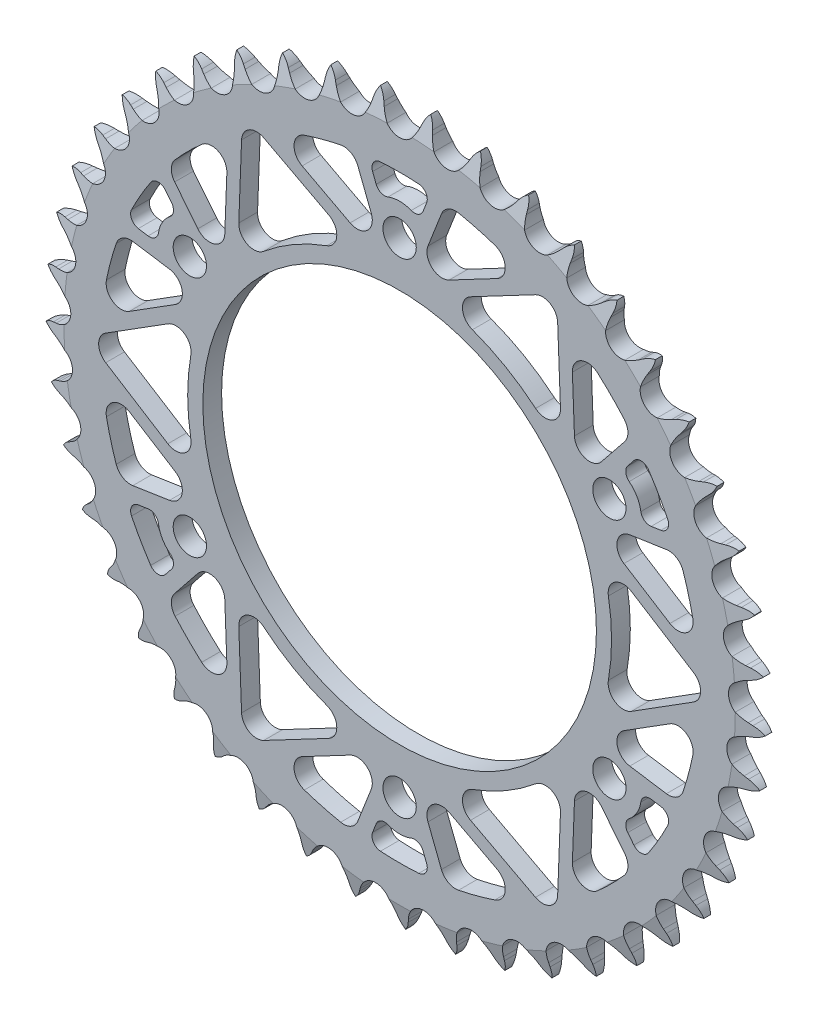
from build123d import *

# Parameters (mm, degrees)
BOSS_EXTRUDE2_DEPTH      = 6.1976
M10_CLEARANCE_HOLE1_D    = 11
SKETCH5_R                = 65
CUT_EXTRUDE1_DEPTH       = 169.066931826
CUT_EXTRUDE5_DEPTH       = 169.066931826
FILLET5_R                = 5
FILLET6_R                = 5
FILLET7_R                = 3
CIRPATTERN1_COUNT        = 6
FILLET5_OF_CIRPATTERN1_R = 5
FILLET6_OF_CIRPATTERN1_R = 5
FILLET7_OF_CIRPATTERN1_R = 3


with BuildPart() as part:
    # Sketch2 → Boss-Extrude2 (new body)
    with BuildSketch(Plane.XY):
        with BuildLine():
            Line((5.956451436, 114.157319132), (6.387056113, 115.368083346))
            ThreePointArc((6.387056113, 115.368083346), (7.1593932, 117.045110566), (8.28683305, 118.507233768))
            ThreePointArc((8.28683305, 118.507233768), (9.199812512, 116.902430548), (9.731236189, 115.134235494))
            Line((9.731236189, 115.134235494), (9.989144441, 113.875325767))
            ThreePointArc((9.989144441, 113.875325767), (10.526532851, 112.014172711), (11.32913636, 110.251077533))
            ThreePointArc((11.32913636, 110.251077533), (15.123673948, 107.610531699), (19.499050656, 109.102870958))
            ThreePointArc((19.499050656, 109.102870958), (20.75653756, 110.57643931), (21.786111761, 112.217370132))
            Line((21.786111761, 112.217370132), (22.381031633, 113.356422684))
            ThreePointArc((22.381031633, 113.356422684), (23.379249467, 114.909640643), (24.69920537, 116.200625263))
            ThreePointArc((24.69920537, 116.200625263), (25.379954338, 114.484377695), (25.660121047, 112.659430712))
            Line((25.660121047, 112.659430712), (25.740312983, 111.376878716))
            ThreePointArc((25.740312983, 111.376878716), (26.013449124, 109.459048263), (26.562866328, 107.601410587))
            ThreePointArc((26.562866328, 107.601410587), (29.952982785, 104.458464801), (34.493472111, 105.327345972))
            ThreePointArc((34.493472111, 105.327345972), (35.943802315, 106.611565307), (37.191730202, 108.093237669))
            Line((37.191730202, 108.093237669), (37.939385831, 109.138408195))
            ThreePointArc((37.939385831, 109.138408195), (39.144055237, 110.537585273), (40.630835752, 111.632303763))
            ThreePointArc((40.630835752, 111.632303763), (41.066104223, 109.838016654), (41.089560838, 107.99183826))
            Line((41.089560838, 107.99183826), (40.990475613, 106.710607411))
            ThreePointArc((40.990475613, 106.710607411), (40.994043201, 104.773427948), (41.279580318, 102.857404578))
            ThreePointArc((41.279580318, 102.857404578), (44.199290883, 99.273232705), (48.816517366, 99.501744005))
            ThreePointArc((48.816517366, 99.501744005), (50.431461843, 100.571618453), (51.873453919, 101.865193288))
            Line((51.873453919, 101.865193288), (52.759293038, 102.796138735))
            ThreePointArc((52.759293038, 102.796138735), (54.146966498, 104.01404154), (55.771633134, 104.891186451))
            ThreePointArc((55.771633134, 104.891186451), (55.9529491, 103.053783557), (55.719239065, 101.222307515))
            Line((55.719239065, 101.222307515), (55.442805261, 99.967335515))
            ThreePointArc((55.442805261, 99.967335515), (55.176734856, 98.048512037), (55.192834232, 96.111396188))
            ThreePointArc((55.192834232, 96.111396188), (57.585310061, 92.155760056), (62.189404639, 91.739453773))
            ThreePointArc((62.189404639, 91.739453773), (63.937530332, 92.574159445), (65.545519861, 93.65445879))
            Line((65.545519861, 93.65445879), (66.55230062, 94.453059362))
            ThreePointArc((66.55230062, 94.453059362), (68.095968646, 95.465982803), (69.826899116, 96.108481506))
            ThreePointArc((69.826899116, 96.108481506), (69.750733469, 94.263725785), (69.264405684, 92.482599692))
            Line((69.264405684, 92.482599692), (68.81600377, 91.278313143))
            ThreePointArc((68.81600377, 91.278313143), (68.28547413, 89.415193367), (68.031822408, 87.494688797))
            ThreePointArc((68.031822408, 87.494688797), (69.85049668, 83.244580363), (74.35184589, 82.191559424))
            ThreePointArc((74.35184589, 82.191559424), (76.199127521, 82.774849725), (77.941816816, 83.620846782))
            Line((77.941816816, 83.620846782), (79.049943371, 84.271558628))
            ThreePointArc((79.049943371, 84.271558628), (80.719560223, 85.059787301), (82.523063933, 85.45513429))
            ThreePointArc((82.523063933, 85.45513429), (82.190899151, 83.638931815), (81.461419433, 81.942823264))
            Line((81.461419433, 81.942823264), (80.849777042, 80.812662234))
            ThreePointArc((80.849777042, 80.812662234), (80.065114323, 79.041509666), (79.546648547, 77.174996811))
            ThreePointArc((79.546648547, 77.174996811), (80.756122835, 72.713139603), (85.067113035, 71.043899863))
            ThreePointArc((85.067113035, 71.043899863), (86.977595368, 71.36442171), (88.821064964, 71.959650108))
            Line((88.821064964, 71.959650108), (90.008968894, 72.449807863))
            ThreePointArc((90.008968894, 72.449807863), (91.772037378, 72.997999794), (93.61301118, 73.138500089))
            ThreePointArc((93.61301118, 73.138500089), (93.031312472, 71.386201174), (92.072879314, 69.80812299))
            Line((92.072879314, 69.80812299), (91.30990137, 68.774084777))
            ThreePointArc((91.30990137, 68.774084777), (90.28637814, 67.129372889), (89.513189654, 65.353181298))
            ThreePointArc((89.513189654, 65.353181298), (90.089922918, 60.76642029), (94.126645586, 58.513451603))
            ThreePointArc((94.126645586, 58.513451603), (96.063143256, 58.564966402), (97.971512115, 58.897840698))
            Line((97.971512115, 58.897840698), (99.21607222, 59.217903998))
            ThreePointArc((99.21607222, 59.217903998), (101.038276214, 59.515389255), (102.880887647, 59.398308178))
            ThreePointArc((102.880887647, 59.398308178), (102.060977118, 57.744019328), (100.892245331, 56.314687007))
            Line((100.892245331, 56.314687007), (99.99278233, 55.39689799))
            ThreePointArc((99.99278233, 55.39689799), (98.750320304, 53.910639226), (97.737458344, 52.259340449))
            ThreePointArc((97.737458344, 52.259340449), (97.670225127, 47.636951727), (101.354110049, 44.844105565))
            ThreePointArc((101.354110049, 44.844105565), (103.278931331, 44.62561064), (105.215055224, 44.689651814))
            Line((105.215055224, 44.689651814), (106.492047557, 44.833390991))
            ThreePointArc((106.492047557, 44.833390991), (108.337919933, 44.874379361), (110.146304662, 44.501995762))
            ThreePointArc((110.146304662, 44.501995762), (109.104140936, 42.977915829), (107.747858555, 41.725149699))
            Line((107.747858555, 41.725149699), (106.729417523, 40.941473596))
            ThreePointArc((106.729417523, 40.941473596), (105.292199811, 39.642596294), (104.059378583, 38.148330983))
            ThreePointArc((104.059378583, 38.148330983), (103.349487502, 33.580284085), (106.608832049, 30.301920022))
            ThreePointArc((106.608832049, 30.301920022), (108.484512486, 29.817668128), (110.410706963, 29.611629692))
            Line((110.410706963, 29.611629692), (111.695276321, 29.576247026))
            ThreePointArc((111.695276321, 29.576247026), (113.528889273, 29.359940718), (115.267849146, 28.739502619))
            ThreePointArc((115.267849146, 28.739502619), (114.023716755, 27.375296085), (112.506282274, 26.323479813))
            Line((112.506282274, 26.323479813), (111.388686007, 25.689169989))
            ThreePointArc((111.388686007, 25.689169989), (109.784686417, 24.602955317), (108.355901383, 23.294807647))
            ThreePointArc((108.355901383, 23.294807647), (107.017169662, 18.87001441), (109.788534398, 15.169942073))
            ThreePointArc((109.788534398, 15.169942073), (111.578566005, 14.429358622), (113.457339881, 13.95725088))
            Line((113.457339881, 13.95725088), (114.724483584, 13.743435054))
            ThreePointArc((114.724483584, 13.743435054), (116.51014792, 13.274044224), (118.145836061, 12.417627749))
            ThreePointArc((118.145836061, 12.417627749), (116.723950628, 11.239847342), (115.074899183, 10.409453336))
            Line((115.074899183, 10.409453336), (113.87990042, 9.936855909))
            ThreePointArc((113.87990042, 9.936855909), (112.14033898, 9.0844458), (110.543399816, 7.987877377))
            ThreePointArc((110.543399816, 7.987877377), (108.601884344, 3.79246137), (110.831327808, -0.257301542))
            ThreePointArc((110.831327808, -0.257301542), (112.500869655, -1.239801935), (114.295654735, -1.968789944))
            Line((114.295654735, -1.968789944), (115.52070927, -2.356877247))
            ThreePointArc((115.52070927, -2.356877247), (117.223669066, -3.070216441), (118.724248666, -4.145942121))
            ThreePointArc((118.724248666, -4.145942121), (117.152285573, -5.114372245), (115.403714074, -5.70718131))
            Line((115.403714074, -5.70718131), (114.154572108, -6.008867768))
            ThreePointArc((114.154572108, -6.008867768), (112.313307402, -6.61088212), (110.579296712, -7.474527839))
            ThreePointArc((110.579296712, -7.474527839), (108.07278688, -11.358907618), (109.716915491, -15.679537076))
            ThreePointArc((109.716915491, -15.679537076), (111.233471845, -16.884831159), (112.909334678, -17.856510512))
            Line((112.909334678, -17.856510512), (114.068455753, -18.411315614))
            ThreePointArc((114.068455753, -18.411315614), (115.655564835, -19.354718836), (116.991828818, -20.628815943))
            ThreePointArc((116.991828818, -20.628815943), (115.300384538, -21.369046394), (113.486326941, -21.712732164))
            Line((113.486326941, -21.712732164), (112.207354899, -21.837635669))
            ThreePointArc((112.207354899, -21.837635669), (110.30022505, -22.17753674), (108.462893381, -22.791449874))
            ThreePointArc((108.462893381, -22.791449874), (105.44017555, -26.289188389), (106.466988215, -30.796588256))
            ThreePointArc((106.466988215, -30.796588256), (107.801041032, -32.20121635), (109.325362854, -33.396674413))
            Line((109.325362854, -33.396674413), (110.395989497, -34.107398665))
            ThreePointArc((110.395989497, -34.107398665), (111.836356589, -35.262503644), (112.982296098, -36.710173328))
            ThreePointArc((112.982296098, -36.710173328), (111.20429267, -37.207796361), (109.360057543, -37.295669384))
            Line((109.360057543, -37.295669384), (108.076149161, -37.241358831))
            ThreePointArc((108.076149161, -37.241358831), (106.140274282, -37.312530834), (104.235383204, -37.664762261))
            ThreePointArc((104.235383204, -37.664762261), (100.75529114, -40.707780012), (101.144802118, -45.314218876))
            ThreePointArc((101.144802118, -45.314218876), (102.270385577, -46.890841493), (103.613497198, -48.286810036))
            Line((103.613497198, -48.286810036), (104.574790878, -49.139619998))
            ThreePointArc((104.574790878, -49.139619998), (105.840380875, -50.483943929), (106.773691501, -52.077008946))
            ThreePointArc((106.773691501, -52.077008946), (104.943735739, -52.322338896), (103.10521902, -52.152688823))
            Line((103.10521902, -52.152688823), (101.841364114, -51.920221306))
            ThreePointArc((101.841364114, -51.920221306), (99.914423809, -51.721278957), (97.979049859, -51.804972894))
            ThreePointArc((97.979049859, -51.804972894), (94.109319595, -54.334041002), (93.853947498, -58.949859769))
            ThreePointArc((93.853947498, -58.949859769), (94.749153398, -60.667789744), (95.884912678, -62.237097826))
            Line((95.884912678, -62.237097826), (96.718162906, -63.215394522))
            ThreePointArc((96.718162906, -63.215394522), (97.784342539, -64.72277167), (98.486858451, -66.430224822))
            ThreePointArc((98.486858451, -66.430224822), (96.640568363, -66.41848662), (94.843554689, -65.994615497))
            Line((94.843554689, -65.994615497), (93.624352758, -65.588515731))
            ThreePointArc((93.624352758, -65.588515731), (91.743852726, -65.123331218), (89.815665758, -64.936858657))
            ThreePointArc((89.815665758, -64.936858657), (85.631617192, -66.902751687), (84.736332548, -71.438108697))
            ThreePointArc((84.736332548, -71.438108697), (85.383736723, -73.263908476), (86.2900374, -74.976011301))
            Line((86.2900374, -74.976011301), (86.979025909, -76.060753299))
            ThreePointArc((86.979025909, -76.060753299), (87.825043203, -77.701844282), (88.283090729, -79.490451935))
            ThreePointArc((88.283090729, -79.490451935), (86.456402251, -79.221874051), (84.735868449, -78.552032047))
            Line((84.735868449, -78.552032047), (83.585049871, -77.980204303))
            ThreePointArc((83.585049871, -77.980204303), (81.787591908, -77.257831913), (79.904121887, -76.804822331))
            ThreePointArc((79.904121887, -76.804822331), (75.487192765, -78.169276411), (73.96942127, -82.535896099))
            ThreePointArc((73.96942127, -82.535896099), (74.356422735, -84.434028567), (75.015624697, -86.255602))
            Line((75.015624697, -86.255602), (75.54694111, -87.425676031))
            ThreePointArc((75.54694111, -87.425676031), (76.156329301, -89.168538879), (76.360993066, -91.00348782))
            ThreePointArc((76.360993066, -91.00348782), (74.589460612, -90.483297818), (72.978894916, -89.580522646))
            Line((72.978894916, -89.580522646), (71.918859065, -88.8540969))
            ThreePointArc((71.918859065, -88.8540969), (70.239428645, -87.88859679), (68.437335173, -87.177867502))
            ThreePointArc((68.437335173, -87.177867502), (63.873495996, -87.914325087), (61.762779346, -92.027216166))
            ThreePointArc((61.762779346, -92.027216166), (61.881845558, -93.960736333), (62.281118189, -95.85632552))
            Line((62.281118189, -95.85632552), (62.644421036, -97.088957424))
            ThreePointArc((62.644421036, -97.088957424), (63.005319075, -98.899669295), (62.952615532, -100.74524433))
            ThreePointArc((62.952615532, -100.74524433), (61.270719966, -99.983567116), (59.801470205, -98.865430267))
            Line((59.801470205, -98.865430267), (58.852849474, -97.99854557))
            ThreePointArc((58.852849474, -97.99854557), (57.324134799, -96.808710101), (55.638493576, -95.854094646))
            ThreePointArc((55.638493576, -95.854094646), (51.016574283, -95.948221425), (48.353995177, -99.72733115))
            ThreePointArc((48.353995177, -99.72733115), (48.202808647, -101.658605246), (48.334380559, -103.591314699))
            Line((48.334380559, -103.591314699), (48.522598563, -104.862512698))
            ThreePointArc((48.522598563, -104.862512698), (48.627981981, -106.705830144), (48.318936945, -108.526109255))
            ThreePointArc((48.318936945, -108.526109255), (46.759414451, -107.537770009), (45.460077899, -106.226034747))
            Line((45.460077899, -106.226034747), (44.641336112, -105.235564023))
            ThreePointArc((44.641336112, -105.235564023), (43.293091875, -103.844551989), (41.75671199, -102.66463087))
            ThreePointArc((41.75671199, -102.66463087), (37.166672982, -102.114594773), (34.004055493, -105.486367071))
            ThreePointArc((34.004055493, -105.486367071), (33.585558896, -107.377805042), (33.446869191, -109.310016771))
            Line((33.446869191, -109.310016771), (33.456338903, -110.595038441))
            ThreePointArc((33.456338903, -110.595038441), (33.304156532, -112.435083386), (32.744785212, -114.194636909))
            ThreePointArc((32.744785212, -114.194636909), (31.337990121, -112.998872532), (30.233856888, -111.51907029))
            Line((30.233856888, -111.51907029), (29.560929921, -110.424291926))
            ThreePointArc((29.560929921, -110.424291926), (28.419398163, -108.859177794), (27.062183502, -107.476916833))
            ThreePointArc((27.062183502, -107.476916833), (22.593364667, -106.293423688), (18.992265548, -109.192230846))
            ThreePointArc((18.992265548, -109.192230846), (18.314604443, -111.007018004), (17.908352559, -112.901123704))
            Line((17.908352559, -112.901123704), (17.738889662, -114.174957562))
            ThreePointArc((17.738889662, -114.174957562), (17.332103558, -115.975915623), (16.533293482, -117.640495851))
            ThreePointArc((16.533293482, -117.640495851), (15.30660746, -116.260580536), (14.419168243, -114.641513981))
            Line((14.419168243, -114.641513981), (13.905153855, -113.463736592))
            ThreePointArc((13.905153855, -113.463736592), (12.992553192, -111.754983529), (11.840920395, -110.197286863))
            ThreePointArc((11.840920395, -110.197286863), (7.580302209, -108.403372017), (3.610812758, -110.772792052))
            ThreePointArc((3.610812758, -110.772792052), (2.687177048, -112.475605628), (2.021270215, -114.294738688))
            Line((2.021270215, -114.294738688), (1.676173111, -115.532591005))
            ThreePointArc((1.676173111, -115.532591005), (1.022700904, -117.259408583), (0, -118.796616355))
            ThreePointArc((0, -118.796616355), (-1.022700904, -117.259408583), (-1.676173111, -115.532591005))
            Line((-1.676173111, -115.532591005), (-2.021270215, -114.294738688))
            ThreePointArc((-2.021270215, -114.294738688), (-2.687177048, -112.475605628), (-3.610812758, -110.772792052))
            ThreePointArc((-3.610812758, -110.772792052), (-7.580302209, -108.403372017), (-11.840920395, -110.197286863))
            ThreePointArc((-11.840920395, -110.197286863), (-12.992553192, -111.754983529), (-13.905153855, -113.463736592))
            Line((-13.905153855, -113.463736592), (-14.419168243, -114.641513981))
            ThreePointArc((-14.419168243, -114.641513981), (-15.30660746, -116.260580536), (-16.533293482, -117.640495851))
            ThreePointArc((-16.533293482, -117.640495851), (-17.332103558, -115.975915623), (-17.738889662, -114.174957562))
            Line((-17.738889662, -114.174957562), (-17.908352559, -112.901123704))
            ThreePointArc((-17.908352559, -112.901123704), (-18.314604443, -111.007018004), (-18.992265548, -109.192230846))
            ThreePointArc((-18.992265548, -109.192230846), (-22.593364667, -106.293423688), (-27.062183502, -107.476916833))
            ThreePointArc((-27.062183502, -107.476916833), (-28.419398163, -108.859177794), (-29.560929921, -110.424291926))
            Line((-29.560929921, -110.424291926), (-30.233856888, -111.51907029))
            ThreePointArc((-30.233856888, -111.51907029), (-31.337990121, -112.998872532), (-32.744785212, -114.194636909))
            ThreePointArc((-32.744785212, -114.194636909), (-33.304156532, -112.435083386), (-33.456338903, -110.595038441))
            Line((-33.456338903, -110.595038441), (-33.446869191, -109.310016771))
            ThreePointArc((-33.446869191, -109.310016771), (-33.585558896, -107.377805042), (-34.004055493, -105.486367071))
            ThreePointArc((-34.004055493, -105.486367071), (-37.166672982, -102.114594773), (-41.75671199, -102.66463087))
            ThreePointArc((-41.75671199, -102.66463087), (-43.293091875, -103.844551989), (-44.641336112, -105.235564023))
            Line((-44.641336112, -105.235564023), (-45.460077899, -106.226034747))
            ThreePointArc((-45.460077899, -106.226034747), (-46.759414451, -107.537770009), (-48.318936945, -108.526109255))
            ThreePointArc((-48.318936945, -108.526109255), (-48.627981981, -106.705830144), (-48.522598563, -104.862512698))
            Line((-48.522598563, -104.862512698), (-48.334380559, -103.591314699))
            ThreePointArc((-48.334380559, -103.591314699), (-48.202808647, -101.658605246), (-48.353995177, -99.72733115))
            ThreePointArc((-48.353995177, -99.72733115), (-51.016574283, -95.948221425), (-55.638493576, -95.854094646))
            ThreePointArc((-55.638493576, -95.854094646), (-57.324134799, -96.808710101), (-58.852849474, -97.99854557))
            Line((-58.852849474, -97.99854557), (-59.801470205, -98.865430267))
            ThreePointArc((-59.801470205, -98.865430267), (-61.270719966, -99.983567116), (-62.952615532, -100.74524433))
            ThreePointArc((-62.952615532, -100.74524433), (-63.005319075, -98.899669295), (-62.644421036, -97.088957424))
            Line((-62.644421036, -97.088957424), (-62.281118189, -95.85632552))
            ThreePointArc((-62.281118189, -95.85632552), (-61.881845558, -93.960736333), (-61.762779346, -92.027216166))
            ThreePointArc((-61.762779346, -92.027216166), (-63.873495996, -87.914325087), (-68.437335173, -87.177867502))
            ThreePointArc((-68.437335173, -87.177867502), (-70.239428645, -87.88859679), (-71.918859065, -88.8540969))
            Line((-71.918859065, -88.8540969), (-72.978894916, -89.580522646))
            ThreePointArc((-72.978894916, -89.580522646), (-74.589460612, -90.483297818), (-76.360993066, -91.00348782))
            ThreePointArc((-76.360993066, -91.00348782), (-76.156329301, -89.168538879), (-75.54694111, -87.425676031))
            Line((-75.54694111, -87.425676031), (-75.015624697, -86.255602))
            ThreePointArc((-75.015624697, -86.255602), (-74.356422735, -84.434028567), (-73.96942127, -82.535896099))
            ThreePointArc((-73.96942127, -82.535896099), (-75.487192765, -78.169276411), (-79.904121887, -76.804822331))
            ThreePointArc((-79.904121887, -76.804822331), (-81.787591908, -77.257831913), (-83.585049871, -77.980204303))
            Line((-83.585049871, -77.980204303), (-84.735868449, -78.552032047))
            ThreePointArc((-84.735868449, -78.552032047), (-86.456402251, -79.221874051), (-88.283090729, -79.490451935))
            ThreePointArc((-88.283090729, -79.490451935), (-87.825043203, -77.701844282), (-86.979025909, -76.060753299))
            Line((-86.979025909, -76.060753299), (-86.2900374, -74.976011301))
            ThreePointArc((-86.2900374, -74.976011301), (-85.383736723, -73.263908476), (-84.736332548, -71.438108697))
            ThreePointArc((-84.736332548, -71.438108697), (-85.631617192, -66.902751687), (-89.815665758, -64.936858657))
            ThreePointArc((-89.815665758, -64.936858657), (-91.743852726, -65.123331218), (-93.624352758, -65.588515731))
            Line((-93.624352758, -65.588515731), (-94.843554689, -65.994615497))
            ThreePointArc((-94.843554689, -65.994615497), (-96.640568363, -66.41848662), (-98.486858451, -66.430224822))
            ThreePointArc((-98.486858451, -66.430224822), (-97.784342539, -64.72277167), (-96.718162906, -63.215394522))
            Line((-96.718162906, -63.215394522), (-95.884912678, -62.237097826))
            ThreePointArc((-95.884912678, -62.237097826), (-94.749153398, -60.667789744), (-93.853947498, -58.949859769))
            ThreePointArc((-93.853947498, -58.949859769), (-94.109319595, -54.334041002), (-97.979049859, -51.804972894))
            ThreePointArc((-97.979049859, -51.804972894), (-99.914423809, -51.721278957), (-101.841364114, -51.920221306))
            Line((-101.841364114, -51.920221306), (-103.10521902, -52.152688823))
            ThreePointArc((-103.10521902, -52.152688823), (-104.943735739, -52.322338896), (-106.773691501, -52.077008946))
            ThreePointArc((-106.773691501, -52.077008946), (-105.840380875, -50.483943929), (-104.574790878, -49.139619998))
            Line((-104.574790878, -49.139619998), (-103.613497198, -48.286810036))
            ThreePointArc((-103.613497198, -48.286810036), (-102.270385577, -46.890841493), (-101.144802118, -45.314218876))
            ThreePointArc((-101.144802118, -45.314218876), (-100.75529114, -40.707780012), (-104.235383204, -37.664762261))
            ThreePointArc((-104.235383204, -37.664762261), (-106.140274282, -37.312530834), (-108.076149161, -37.241358831))
            Line((-108.076149161, -37.241358831), (-109.360057543, -37.295669384))
            ThreePointArc((-109.360057543, -37.295669384), (-111.20429267, -37.207796361), (-112.982296098, -36.710173328))
            ThreePointArc((-112.982296098, -36.710173328), (-111.836356589, -35.262503644), (-110.395989497, -34.107398665))
            Line((-110.395989497, -34.107398665), (-109.325362854, -33.396674413))
            ThreePointArc((-109.325362854, -33.396674413), (-107.801041032, -32.20121635), (-106.466988215, -30.796588256))
            ThreePointArc((-106.466988215, -30.796588256), (-105.44017555, -26.289188389), (-108.462893381, -22.791449874))
            ThreePointArc((-108.462893381, -22.791449874), (-110.30022505, -22.17753674), (-112.207354899, -21.837635669))
            Line((-112.207354899, -21.837635669), (-113.486326941, -21.712732164))
            ThreePointArc((-113.486326941, -21.712732164), (-115.300384538, -21.369046394), (-116.991828818, -20.628815943))
            ThreePointArc((-116.991828818, -20.628815943), (-115.655564835, -19.354718836), (-114.068455753, -18.411315614))
            Line((-114.068455753, -18.411315614), (-112.909334678, -17.856510512))
            ThreePointArc((-112.909334678, -17.856510512), (-111.233471845, -16.884831159), (-109.716915491, -15.679537076))
            ThreePointArc((-109.716915491, -15.679537076), (-108.07278688, -11.358907618), (-110.579296712, -7.474527839))
            ThreePointArc((-110.579296712, -7.474527839), (-112.313307402, -6.61088212), (-114.154572108, -6.008867768))
            Line((-114.154572108, -6.008867768), (-115.403714074, -5.70718131))
            ThreePointArc((-115.403714074, -5.70718131), (-117.152285573, -5.114372245), (-118.724248666, -4.145942121))
            ThreePointArc((-118.724248666, -4.145942121), (-117.223669066, -3.070216441), (-115.52070927, -2.356877247))
            Line((-115.52070927, -2.356877247), (-114.295654735, -1.968789944))
            ThreePointArc((-114.295654735, -1.968789944), (-112.500869655, -1.239801935), (-110.831327808, -0.257301542))
            ThreePointArc((-110.831327808, -0.257301542), (-108.601884344, 3.79246137), (-110.543399816, 7.987877377))
            ThreePointArc((-110.543399816, 7.987877377), (-112.14033898, 9.0844458), (-113.87990042, 9.936855909))
            Line((-113.87990042, 9.936855909), (-115.074899183, 10.409453336))
            ThreePointArc((-115.074899183, 10.409453336), (-116.723950628, 11.239847342), (-118.145836061, 12.417627749))
            ThreePointArc((-118.145836061, 12.417627749), (-116.51014792, 13.274044224), (-114.724483584, 13.743435054))
            Line((-114.724483584, 13.743435054), (-113.457339881, 13.95725088))
            ThreePointArc((-113.457339881, 13.95725088), (-111.578566005, 14.429358622), (-109.788534398, 15.169942073))
            ThreePointArc((-109.788534398, 15.169942073), (-107.017169662, 18.87001441), (-108.355901383, 23.294807647))
            ThreePointArc((-108.355901383, 23.294807647), (-109.784686417, 24.602955317), (-111.388686007, 25.689169989))
            Line((-111.388686007, 25.689169989), (-112.506282274, 26.323479813))
            ThreePointArc((-112.506282274, 26.323479813), (-114.023716755, 27.375296085), (-115.267849146, 28.739502619))
            ThreePointArc((-115.267849146, 28.739502619), (-113.528889273, 29.359940718), (-111.695276321, 29.576247026))
            Line((-111.695276321, 29.576247026), (-110.410706963, 29.611629692))
            ThreePointArc((-110.410706963, 29.611629692), (-108.484512486, 29.817668128), (-106.608832049, 30.301920022))
            ThreePointArc((-106.608832049, 30.301920022), (-103.349487502, 33.580284085), (-104.059378583, 38.148330983))
            ThreePointArc((-104.059378583, 38.148330983), (-105.292199811, 39.642596294), (-106.729417523, 40.941473596))
            Line((-106.729417523, 40.941473596), (-107.747858555, 41.725149699))
            ThreePointArc((-107.747858555, 41.725149699), (-109.104140936, 42.977915829), (-110.146304662, 44.501995762))
            ThreePointArc((-110.146304662, 44.501995762), (-108.337919933, 44.874379361), (-106.492047557, 44.833390991))
            Line((-106.492047557, 44.833390991), (-105.215055224, 44.689651814))
            ThreePointArc((-105.215055224, 44.689651814), (-103.278931331, 44.62561064), (-101.354110049, 44.844105565))
            ThreePointArc((-101.354110049, 44.844105565), (-97.670225127, 47.636951727), (-97.737458344, 52.259340449))
            ThreePointArc((-97.737458344, 52.259340449), (-98.750320304, 53.910639226), (-99.99278233, 55.39689799))
            Line((-99.99278233, 55.39689799), (-100.892245331, 56.314687007))
            ThreePointArc((-100.892245331, 56.314687007), (-102.060977118, 57.744019328), (-102.880887647, 59.398308178))
            ThreePointArc((-102.880887647, 59.398308178), (-101.038276214, 59.515389255), (-99.21607222, 59.217903998))
            Line((-99.21607222, 59.217903998), (-97.971512115, 58.897840698))
            ThreePointArc((-97.971512115, 58.897840698), (-96.063143256, 58.564966402), (-94.126645586, 58.513451603))
            ThreePointArc((-94.126645586, 58.513451603), (-90.089922918, 60.76642029), (-89.513189654, 65.353181298))
            ThreePointArc((-89.513189654, 65.353181298), (-90.28637814, 67.129372889), (-91.30990137, 68.774084777))
            Line((-91.30990137, 68.774084777), (-92.072879314, 69.80812299))
            ThreePointArc((-92.072879314, 69.80812299), (-93.031312472, 71.386201174), (-93.61301118, 73.138500089))
            ThreePointArc((-93.61301118, 73.138500089), (-91.772037378, 72.997999794), (-90.008968894, 72.449807863))
            Line((-90.008968894, 72.449807863), (-88.821064964, 71.959650108))
            ThreePointArc((-88.821064964, 71.959650108), (-86.977595368, 71.36442171), (-85.067113035, 71.043899863))
            ThreePointArc((-85.067113035, 71.043899863), (-80.756122835, 72.713139603), (-79.546648547, 77.174996811))
            ThreePointArc((-79.546648547, 77.174996811), (-80.065114323, 79.041509666), (-80.849777042, 80.812662234))
            Line((-80.849777042, 80.812662234), (-81.461419433, 81.942823264))
            ThreePointArc((-81.461419433, 81.942823264), (-82.190899151, 83.638931815), (-82.523063933, 85.45513429))
            ThreePointArc((-82.523063933, 85.45513429), (-80.719560223, 85.059787301), (-79.049943371, 84.271558628))
            Line((-79.049943371, 84.271558628), (-77.941816816, 83.620846782))
            ThreePointArc((-77.941816816, 83.620846782), (-76.199127521, 82.774849725), (-74.35184589, 82.191559424))
            ThreePointArc((-74.35184589, 82.191559424), (-69.85049668, 83.244580363), (-68.031822408, 87.494688797))
            ThreePointArc((-68.031822408, 87.494688797), (-68.28547413, 89.415193367), (-68.81600377, 91.278313143))
            Line((-68.81600377, 91.278313143), (-69.264405684, 92.482599692))
            ThreePointArc((-69.264405684, 92.482599692), (-69.750733469, 94.263725785), (-69.826899116, 96.108481506))
            ThreePointArc((-69.826899116, 96.108481506), (-68.095968646, 95.465982803), (-66.55230062, 94.453059362))
            Line((-66.55230062, 94.453059362), (-65.545519861, 93.65445879))
            ThreePointArc((-65.545519861, 93.65445879), (-63.937530332, 92.574159445), (-62.189404639, 91.739453773))
            ThreePointArc((-62.189404639, 91.739453773), (-57.585310061, 92.155760056), (-55.192834232, 96.111396188))
            ThreePointArc((-55.192834232, 96.111396188), (-55.176734856, 98.048512037), (-55.442805261, 99.967335515))
            Line((-55.442805261, 99.967335515), (-55.719239065, 101.222307515))
            ThreePointArc((-55.719239065, 101.222307515), (-55.9529491, 103.053783557), (-55.771633134, 104.891186451))
            ThreePointArc((-55.771633134, 104.891186451), (-54.146966498, 104.01404154), (-52.759293038, 102.796138735))
            Line((-52.759293038, 102.796138735), (-51.873453919, 101.865193288))
            ThreePointArc((-51.873453919, 101.865193288), (-50.431461843, 100.571618453), (-48.816517366, 99.501744005))
            ThreePointArc((-48.816517366, 99.501744005), (-44.199290883, 99.273232705), (-41.279580318, 102.857404578))
            ThreePointArc((-41.279580318, 102.857404578), (-40.994043201, 104.773427948), (-40.990475613, 106.710607411))
            Line((-40.990475613, 106.710607411), (-41.089560838, 107.99183826))
            ThreePointArc((-41.089560838, 107.99183826), (-41.066104223, 109.838016654), (-40.630835752, 111.632303763))
            ThreePointArc((-40.630835752, 111.632303763), (-39.144055237, 110.537585273), (-37.939385831, 109.138408195))
            Line((-37.939385831, 109.138408195), (-37.191730202, 108.093237669))
            ThreePointArc((-37.191730202, 108.093237669), (-35.943802315, 106.611565307), (-34.493472111, 105.327345972))
            ThreePointArc((-34.493472111, 105.327345972), (-29.952982785, 104.458464801), (-26.562866328, 107.601410587))
            ThreePointArc((-26.562866328, 107.601410587), (-26.013449124, 109.459048263), (-25.740312983, 111.376878716))
            Line((-25.740312983, 111.376878716), (-25.660121047, 112.659430712))
            ThreePointArc((-25.660121047, 112.659430712), (-25.379954338, 114.484377695), (-24.69920537, 116.200625263))
            ThreePointArc((-24.69920537, 116.200625263), (-23.379249467, 114.909640643), (-22.381031633, 113.356422684))
            Line((-22.381031633, 113.356422684), (-21.786111761, 112.217370132))
            ThreePointArc((-21.786111761, 112.217370132), (-20.75653756, 110.57643931), (-19.499050656, 109.102870958))
            ThreePointArc((-19.499050656, 109.102870958), (-15.123673948, 107.610531699), (-11.32913636, 110.251077533))
            ThreePointArc((-11.32913636, 110.251077533), (-10.526532851, 112.014172711), (-9.989144441, 113.875325767))
            Line((-9.989144441, 113.875325767), (-9.731236189, 115.134235494))
            ThreePointArc((-9.731236189, 115.134235494), (-9.199812512, 116.902430548), (-8.28683305, 118.507233768))
            ThreePointArc((-8.28683305, 118.507233768), (-7.1593932, 117.045110566), (-6.387056113, 115.368083346))
            Line((-6.387056113, 115.368083346), (-5.956451436, 114.157319132))
            ThreePointArc((-5.956451436, 114.157319132), (-5.165270411, 112.389068701), (-4.125102361, 110.754832664))
            ThreePointArc((-4.125102361, 110.754832664), (0, 108.668082003), (4.125102361, 110.754832664))
            ThreePointArc((4.125102361, 110.754832664), (5.165270411, 112.389068701), (5.956451436, 114.157319132))
        make_face()
    extrude(amount=BOSS_EXTRUDE2_DEPTH)

    # Sketch4 → Cut-Revolve1 (revolve, cut)
    with BuildSketch(Plane(origin=(0, 0, 0), x_dir=(0, 0, -1), z_dir=(0.9781476007338068, 0.2079116908177541, 0))):
        Polygon((-6.1976, 118.796616355), (-6.1976, 110.859116355), (-4.213225, 118.796616355), align=None)
        Polygon((0, 110.859116355), (0, 118.796616355), (-1.984375, 118.796616355), align=None)
    revolve(axis=Axis((0, 0, -0.30988), (0, 0, 1)), mode=Mode.SUBTRACT)

    # M10 Clearance Hole1 (through all)
    with Locations(Plane.XY.offset(6.1976)):
        with Locations((0, 80), (69.282032303, 40), (69.282032303, -40), (0, -80), (-69.282032303, -40), (-69.282032303, 40)):
            Hole(M10_CLEARANCE_HOLE1_D / 2)

    # Sketch5 → Cut-Extrude1 (cut, through all)
    with BuildSketch(Plane.XY.offset(6.1976)):
        Circle(SKETCH5_R)
    extrude(amount=-CUT_EXTRUDE1_DEPTH, mode=Mode.SUBTRACT)

    # Sketch9 → Cut-Extrude5 (cut, through all)
    with BuildSketch(Plane.XY.offset(6.1976)):
        with BuildLine():
            Line((15.311261123, 97.594963383), (4.483177356, 69.856289057))
            Line((4.483177356, 69.856289057), (41.767986929, 89.52456011))
            ThreePointArc((41.767986929, 89.52456011), (28.823479869, 94.490309573), (15.311261123, 97.594963383))
        make_face()
        with BuildLine():
            ThreePointArc((-53.608497729, 45.012542376), (-35, 60.621778265), (-12.177756322, 68.932592081))
            Line((-12.177756322, 68.932592081), (-51.894361002, 89.883669881))
            Line((-51.894361002, 89.883669881), (-53.608497729, 45.012542376))
        make_face()
        with BuildLine():
            Line((-41.767986929, 89.52456011), (-4.483177356, 69.856289057))
            Line((-4.483177356, 69.856289057), (-15.311261123, 97.594963383))
            ThreePointArc((-15.311261123, 97.594963383), (-28.823479869, 94.490309573), (-41.767986929, 89.52456011))
        make_face()
        with BuildLine():
            Line((6.490002191, 88.254082115), (10.388494251, 98.240983211))
            ThreePointArc((10.388494251, 98.240983211), (0, 98.788722003), (-10.388494251, 98.240983211))
            Line((-10.388494251, 98.240983211), (-6.490002191, 88.254082115))
            ThreePointArc((-6.490002191, 88.254082115), (0, 90.5), (6.490002191, 88.254082115))
        make_face()
    cut_extrude5 = extrude(amount=-CUT_EXTRUDE5_DEPTH, mode=Mode.SUBTRACT)

    # Fillet5
    fillet5_edges = [part.edges().sort_by_distance(p)[0] for p in [
        (-53.608497729, 45.012542376, 3.0988),
        (-12.177756322, 68.932592081, 3.0988),
        (-51.894361002, 89.883669881, 3.0988),
    ]]
    fillet(fillet5_edges, radius=FILLET5_R)

    # Fillet6
    fillet6_edges = [part.edges().sort_by_distance(p)[0] for p in [
        (4.483177356, 69.856289057, 3.0988),
        (41.767986929, 89.52456011, 3.0988),
        (15.311261123, 97.594963383, 3.0988),
        (-4.483177356, 69.856289057, 3.0988),
        (-15.311261123, 97.594963383, 3.0988),
        (-41.767986929, 89.52456011, 3.0988),
    ]]
    fillet(fillet6_edges, radius=FILLET6_R)

    # Fillet7
    fillet7_edges = [part.edges().sort_by_distance(p)[0] for p in [
        (-6.490002191, 88.254082115, 3.0988),
        (6.490002191, 88.254082115, 3.0988),
        (10.388494251, 98.240983211, 3.0988),
        (-10.388494251, 98.240983211, 3.0988),
    ]]
    fillet(fillet7_edges, radius=FILLET7_R)

    # CirPattern1: Cut-Extrude5 ×6 about axis
    cirpattern1_axis = Axis((0, 0, -0.30988), (0, 0, 1))
    for i in range(1, CIRPATTERN1_COUNT):
        add(cut_extrude5.rotate(cirpattern1_axis, i * 360 / CIRPATTERN1_COUNT), mode=Mode.SUBTRACT)

    # Fillet5 of CirPattern1
    fillet5_of_cirpattern1_edges = [part.edges().sort_by_distance(p)[0] for p in [
        (-65.786254052, -23.920049704, 3.0988),
        (-65.786254052, 23.920049704, 3.0988),
        (-103.788722003, 0, 3.0988),
        (-12.177756322, -68.932592081, 3.0988),
        (-53.608497729, -45.012542376, 3.0988),
        (-51.894361001, -89.883669881, 3.0988),
        (53.608497729, -45.012542376, 3.0988),
        (12.177756322, -68.932592081, 3.0988),
        (51.894361002, -89.883669881, 3.0988),
        (65.786254052, 23.920049704, 3.0988),
        (65.786254052, -23.920049704, 3.0988),
        (103.788722003, 0, 3.0988),
        (12.177756322, 68.932592081, 3.0988),
        (53.608497729, 45.012542376, 3.0988),
        (51.894361001, 89.883669881, 3.0988),
    ]]
    fillet(fillet5_of_cirpattern1_edges, radius=FILLET5_OF_CIRPATTERN1_R)

    # Fillet6 of CirPattern1
    fillet6_of_cirpattern1_edges = [part.edges().sort_by_distance(p)[0] for p in [
        (-58.255732259, 38.810690008, 3.0988),
        (-56.646549853, 80.9344178, 3.0988),
        (-76.86408701, 62.057422788, 3.0988),
        (-62.738909615, 31.045599049, 3.0988),
        (-92.175348133, 35.537540596, 3.0988),
        (-98.414536782, 8.590142309, 3.0988),
        (-62.738909615, -31.045599049, 3.0988),
        (-98.414536782, -8.590142309, 3.0988),
        (-92.175348133, -35.537540596, 3.0988),
        (-58.255732259, -38.810690008, 3.0988),
        (-76.86408701, -62.057422788, 3.0988),
        (-56.646549853, -80.9344178, 3.0988),
        (-4.483177356, -69.856289057, 3.0988),
        (-41.767986929, -89.52456011, 3.0988),
        (-15.311261123, -97.594963383, 3.0988),
        (4.483177356, -69.856289057, 3.0988),
        (15.311261123, -97.594963383, 3.0988),
        (41.767986929, -89.52456011, 3.0988),
        (58.255732259, -38.810690008, 3.0988),
        (56.646549853, -80.9344178, 3.0988),
        (76.86408701, -62.057422788, 3.0988),
        (62.738909615, -31.045599049, 3.0988),
        (92.175348133, -35.537540596, 3.0988),
        (98.414536782, -8.590142309, 3.0988),
        (62.738909615, 31.045599049, 3.0988),
        (98.414536782, 8.590142309, 3.0988),
        (92.175348133, 35.537540596, 3.0988),
        (58.255732259, 38.810690008, 3.0988),
        (76.86408701, 62.057422788, 3.0988),
        (56.646549853, 80.9344178, 3.0988),
    ]]
    fillet(fillet6_of_cirpattern1_edges, radius=FILLET6_OF_CIRPATTERN1_R)

    # Fillet7 of CirPattern1
    fillet7_of_cirpattern1_edges = [part.edges().sort_by_distance(p)[0] for p in [
        (-79.675278195, 38.50653429, 3.0988),
        (-73.185276004, 49.747547825, 3.0988),
        (-79.884940027, 58.117191534, 3.0988),
        (-90.273434279, 40.123791677, 3.0988),
        (-73.185276004, -49.747547825, 3.0988),
        (-79.675278195, -38.50653429, 3.0988),
        (-90.273434279, -40.123791677, 3.0988),
        (-79.884940027, -58.117191534, 3.0988),
        (6.490002191, -88.254082115, 3.0988),
        (-6.490002191, -88.254082115, 3.0988),
        (-10.388494251, -98.240983211, 3.0988),
        (10.388494251, -98.240983211, 3.0988),
        (79.675278195, -38.50653429, 3.0988),
        (73.185276004, -49.747547825, 3.0988),
        (79.884940027, -58.117191534, 3.0988),
        (90.273434279, -40.123791677, 3.0988),
        (73.185276004, 49.747547825, 3.0988),
        (79.675278195, 38.50653429, 3.0988),
        (90.273434279, 40.123791677, 3.0988),
        (79.884940027, 58.117191534, 3.0988),
    ]]
    fillet(fillet7_of_cirpattern1_edges, radius=FILLET7_OF_CIRPATTERN1_R)


solid = part.part
